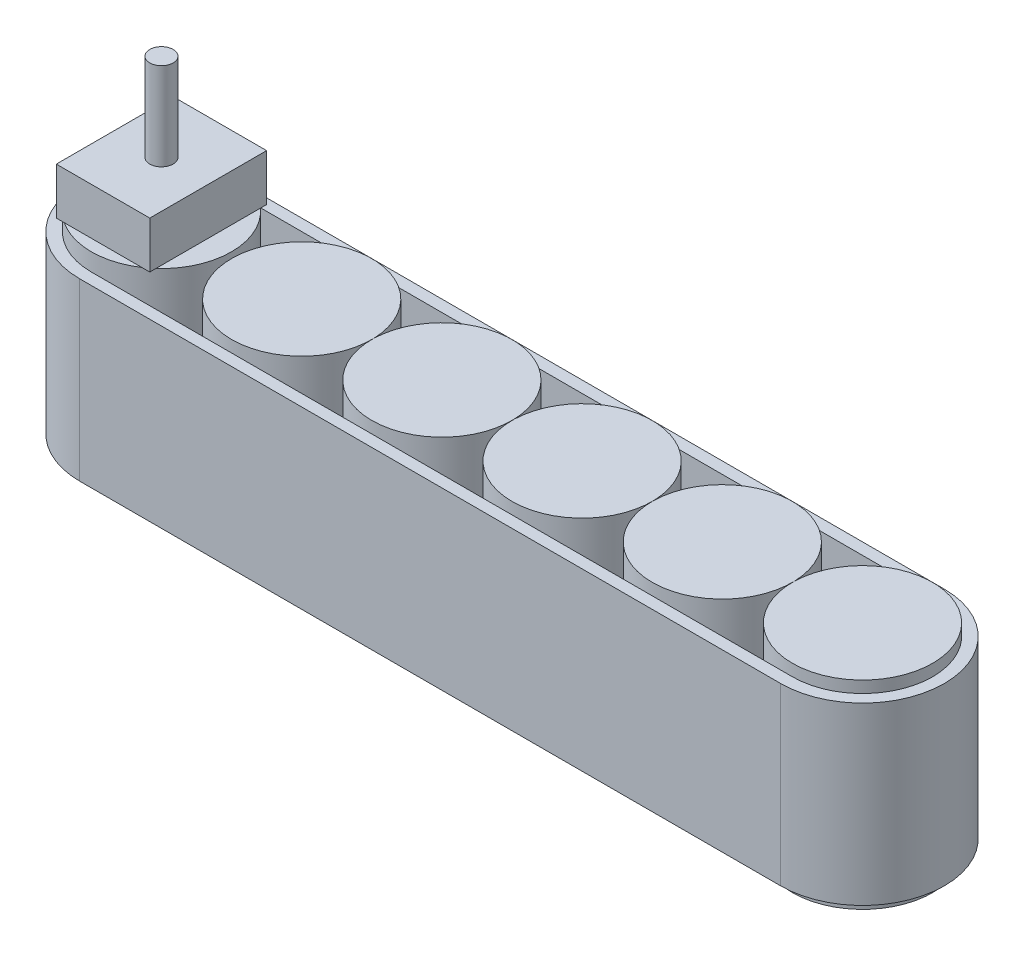
from build123d import *

# Parameters (mm, degrees)
BOSS_EXTRUDE1_DEPTH = 75
SKETCH3_R           = 60
BOSS_EXTRUDE2_DEPTH = 85
SKETCH4_R           = 12.5
BOSS_EXTRUDE3_DEPTH = 40
SKETCH5_R           = 10
BOSS_EXTRUDE4_DEPTH = 120
BOSS_EXTRUDE7_START = 5
SKETCH6_R           = 60
BOSS_EXTRUDE7_DEPTH = 5
SKETCH7_W           = 80
SKETCH7_H           = 100
SKETCH7_R           = 10
BOSS_EXTRUDE8_DEPTH = 40


with BuildPart() as part:
    # Sketch1 → Boss-Extrude1 (new, symmetric)
    with BuildSketch(Plane(origin=(0, 0, 0), x_dir=(1, 0, 0), z_dir=(0, 1, 0))):
        with BuildLine():
            Line((0, 70), (600, 70))
            ThreePointArc((600, 70), (670, 0), (600, -70))
            Line((600, -70), (0, -70))
            ThreePointArc((0, -70), (-70, 0), (0, 70))
        make_face()
        with BuildLine():
            Line((0, 60), (600, 60))
            ThreePointArc((600, 60), (660, 0), (600, -60))
            Line((600, -60), (0, -60))
            ThreePointArc((0, -60), (-60, 0), (0, 60))
        make_face(mode=Mode.SUBTRACT)
    extrude(amount=BOSS_EXTRUDE1_DEPTH, both=True)

    # Sketch3 → Boss-Extrude2 (add, symmetric)
    with BuildSketch(Plane(origin=(0, 0, 0), x_dir=(1, 0, 0), z_dir=(0, 1, 0))):
        Circle(SKETCH3_R)
        with Locations((600, 0)):
            Circle(SKETCH3_R)
        with BuildLine():
            ThreePointArc((540, 0), (480, 60), (420, 0))
            ThreePointArc((420, 0), (480, -60), (540, 0))
        make_face()
        with BuildLine():
            ThreePointArc((420, 0), (360, 60), (300, 0))
            ThreePointArc((300, 0), (360, -60), (420, 0))
        make_face()
        with BuildLine():
            ThreePointArc((300, 0), (240, 60), (180, 0))
            ThreePointArc((180, 0), (240, -60), (300, 0))
        make_face()
        with BuildLine():
            ThreePointArc((180, 0), (120, 60), (60, 0))
            ThreePointArc((60, 0), (120, -60), (180, 0))
        make_face()
    extrude(amount=BOSS_EXTRUDE2_DEPTH, both=True)

    # Sketch4 → Boss-Extrude3 (add)
    with BuildSketch(Plane.XZ.offset(85)):
        Circle(SKETCH4_R)
    extrude(amount=BOSS_EXTRUDE3_DEPTH)

    # Sketch5 → Boss-Extrude4 (add)
    with BuildSketch(Plane(origin=(0, 85, 0), x_dir=(1, 0, 0), z_dir=(0, 1, 0))):
        Circle(SKETCH5_R)
    extrude(amount=BOSS_EXTRUDE4_DEPTH)

    # Sketch6 → Boss-Extrude7 (add)
    with BuildSketch(Plane(origin=(0, 85, 0), x_dir=(1, 0, 0), z_dir=(0, 1, 0)).offset(BOSS_EXTRUDE7_START)):
        Circle(SKETCH6_R)
    extrude(amount=-BOSS_EXTRUDE7_DEPTH)

    # Sketch7 → Boss-Extrude8 (add)
    with BuildSketch(Plane(origin=(0, 90, 0), x_dir=(1, 0, 0), z_dir=(0, 1, 0))):
        Rectangle(SKETCH7_W, SKETCH7_H)
        Circle(SKETCH7_R, mode=Mode.SUBTRACT)
    extrude(amount=BOSS_EXTRUDE8_DEPTH)


solid = part.part
